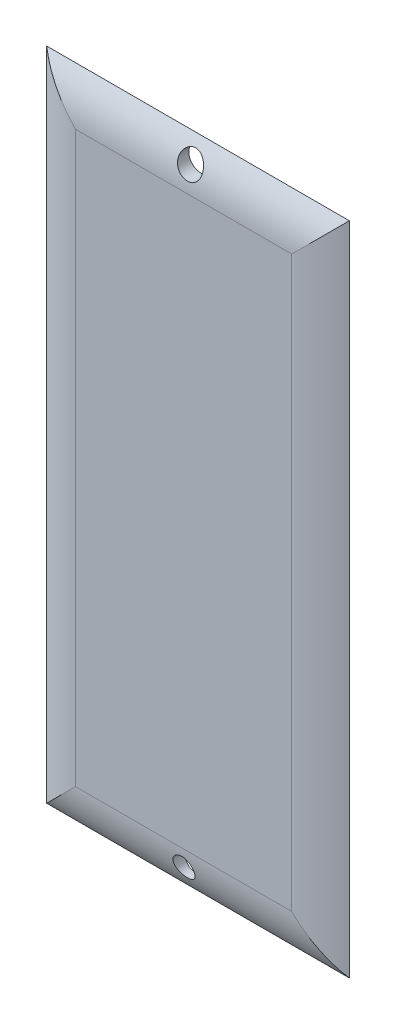
from build123d import *

# Parameters (mm, degrees)
SKETCH1_W           = 42
SKETCH1_H           = 91
BOSS_EXTRUDE1_DEPTH = 2
SKETCH2_R           = 1.492291875
SKETCH2_R_2         = 1.71386304
CUT_EXTRUDE1_DEPTH  = 2
FILLET1_R           = 10


with BuildPart() as part:
    # Sketch1 → Boss-Extrude1 (new body)
    with BuildSketch(Plane.XY):
        Rectangle(SKETCH1_W, SKETCH1_H)
    extrude(amount=BOSS_EXTRUDE1_DEPTH)

    # Sketch2 → Cut-Extrude1 (cut)
    with BuildSketch(Plane.XY.offset(2)):
        with Locations((-0.283052716, -42.049438223)):
            Circle(SKETCH2_R)
        with Locations((0.438366209, 42.637044582)):
            Circle(SKETCH2_R_2)
    extrude(amount=-CUT_EXTRUDE1_DEPTH, mode=Mode.SUBTRACT)

    # Fillet1
    # the kernel refuses this fillet: 10 mm, written as the material it takes off along each edge
    with BuildSketch(Plane(origin=(-36, 45.5, 2), x_dir=(0, 0, -1), z_dir=(1, 0, 0))) as fillet1_piece_1:
        with BuildLine():
            CenterArc((10, -6), FILLET1_R, 143.130102354, 36.869897646)
            Line((0, -6), (-0.2, -6))
            Line((-0.2, -6), (-0.2, 0))
            Line((-0.2, 0), (0, 0.2))
            ThreePointArc((0, 0.2), (1, 0.2), (1.84, 0.12))
            Line((1.84, 0.12), (2, 0))
        make_face()
    extrude(amount=72, mode=Mode.SUBTRACT)
    with BuildSketch(Plane(origin=(-21, -60.5, 2), x_dir=(0, 0, -1), z_dir=(0, 1, 0)), Plane(origin=(21, 60.5, 2), x_dir=(0, 0, -1), z_dir=(0, -1, 0))) as fillet1_piece_2:
        with BuildLine():
            CenterArc((10, -6), FILLET1_R, 143.130102354, 36.869897646)
            Line((0, -6), (-0.2, -6))
            Line((-0.2, -6), (-0.2, 0))
            Line((-0.2, 0), (0, 0.2))
            ThreePointArc((0, 0.2), (1, 0.2), (1.84, 0.12))
            Line((1.84, 0.12), (2, 0))
        make_face()
    extrude(amount=121, mode=Mode.SUBTRACT)
    with BuildSketch(Plane(origin=(36, -45.5, 2), x_dir=(0, 1, 0), z_dir=(-1, 0, 0))) as fillet1_piece_3:
        with BuildLine():
            CenterArc((6, 10), FILLET1_R, 233.130102354, 36.869897646)
            Line((0, 2), (-0.12, 1.84))
            ThreePointArc((-0.12, 1.84), (-0.2, 1), (-0.2, 0))
            Line((-0.2, 0), (0, -0.2))
            Line((0, -0.2), (6, -0.2))
            Line((6, -0.2), (6, 0))
        make_face()
    extrude(amount=72, mode=Mode.SUBTRACT)


solid = part.part
